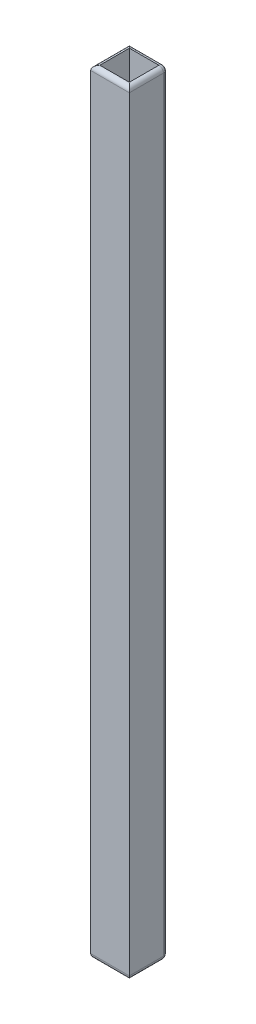
from build123d import *

# Parameters (mm, degrees)
SKETCH1_W           = 8.5
SKETCH1_H           = 8.5
SKETCH1_W_2         = 6.5
SKETCH1_H_2         = 6.5
BOSS_EXTRUDE1_DEPTH = 85.1
FILLET1_R           = 1
FILLET2_R           = 1
FILLET3_R           = 1


with BuildPart() as part:
    # Sketch1 → Boss-Extrude1 (new, symmetric)
    with BuildSketch(Plane(origin=(0, 0, 0), x_dir=(1, 0, 0), z_dir=(0, 1, 0))):
        Rectangle(SKETCH1_W, SKETCH1_H)
        Rectangle(SKETCH1_W_2, SKETCH1_H_2, mode=Mode.SUBTRACT)
    extrude(amount=BOSS_EXTRUDE1_DEPTH, both=True)

    # Fillet1
    fillet1_edges = [part.edges().sort_by_distance(p)[0] for p in [
        (4.25, 0, -4.25),
    ]]
    fillet(fillet1_edges, radius=FILLET1_R)

    # Fillet2
    fillet2_edges = [part.edges().sort_by_distance(p)[0] for p in [
        (-4.25, 85.1, 0),
        (0, 85.1, 4.25),
        (-0.5, 85.1, -4.25),
        (3.957106781, 85.1, -3.957106781),
        (4.25, 85.1, 0.5),
    ]]
    fillet(fillet2_edges, radius=FILLET2_R - 0.0001)  # a hair under: the kernel refuses the full size

    # Fillet3
    fillet3_edges = [part.edges().sort_by_distance(p)[0] for p in [
        (-0.5, -85.1, -4.25),
        (3.957106781, -85.1, -3.957106781),
        (0, -85.1, 4.25),
        (-4.25, -85.1, 0),
        (4.25, -85.1, 0.5),
    ]]
    fillet(fillet3_edges, radius=FILLET3_R - 0.0001)  # a hair under: the kernel refuses the full size


solid = part.part
